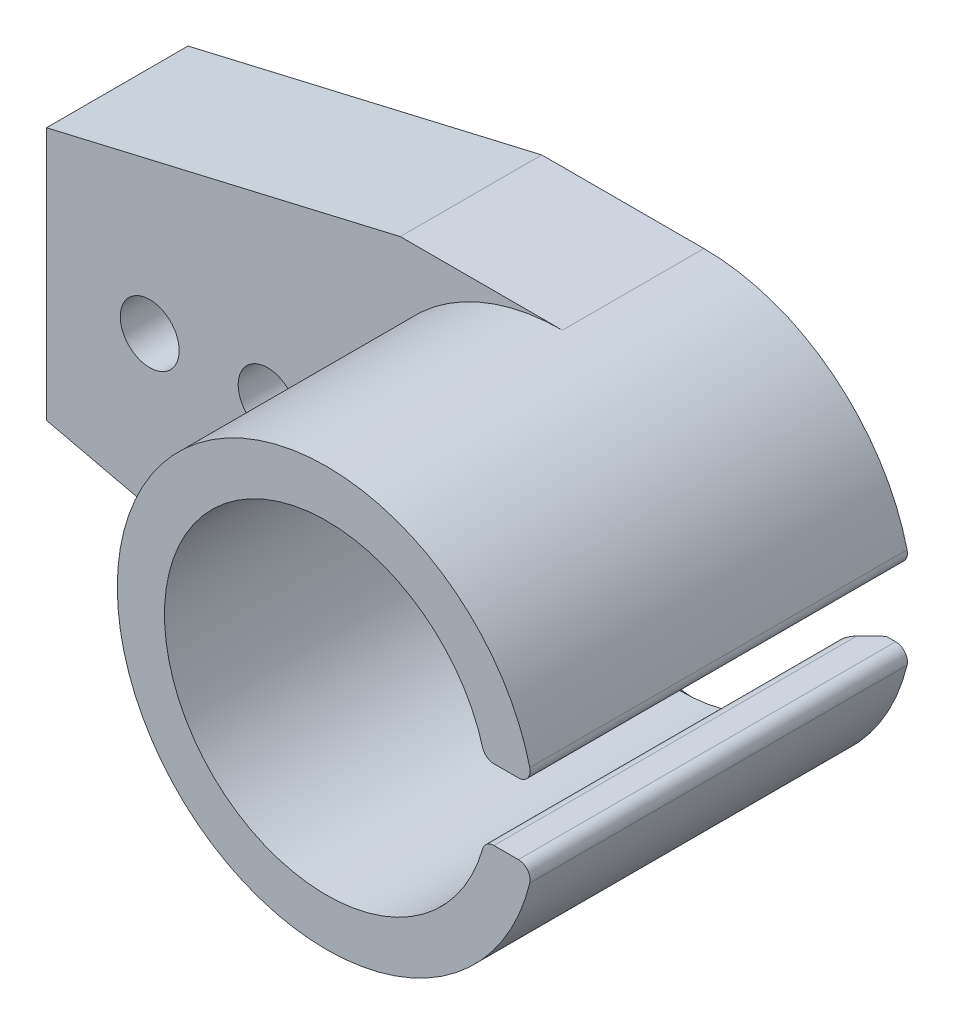
from build123d import *
from build123d.topology import SkipClean

# Parameters (mm, degrees)
ESQUISSE1_R             = 2.5
BOSS_EXTRU_1_DEPTH      = 32
CHANFREIN1_SIZE         = 2
CONG_2_R                = 1
ENL_V_MAT_EXTRU_1_DEPTH = 2
ENL_V_START             = -20
ENL_V_MAT_EXTRU_2_DEPTH = 20
ENL_V_MAT_EXTRU_3_DEPTH = 52.274993944


with BuildPart() as part:
    # Esquisse1 → Boss.-Extru.1 (new body)
    with BuildSketch(Plane.XY):
        with BuildLine():
            Line((13.4187369, 3), (17.494642037, 3))
            ThreePointArc((17.494642037, 3), (11.441426921, 13.570418195), (0, 17.75))
            Line((0, 17.75), (-43.75, 17.75))
            Line((-43.75, 17.75), (-43.75, -17.75))
            Line((-43.75, -17.75), (0, -17.75))
            ThreePointArc((0, -17.75), (11.441426921, -13.570418195), (17.494642037, -3))
            Line((17.494642037, -3), (13.4187369, -3))
            ThreePointArc((13.4187369, -3), (-13.75, 0), (13.4187369, 3))
        make_face()
        with Locations((-35, 0)):
            Circle(ESQUISSE1_R, mode=Mode.SUBTRACT)
        with Locations((-25, 0)):
            Circle(ESQUISSE1_R, mode=Mode.SUBTRACT)
    extrude(amount=BOSS_EXTRU_1_DEPTH)

    # Chanfrein1
    chanfrein1_edges = [part.edges().sort_by_distance(p)[0] for p in [
        (-13.75, 0, 0),
    ]]
    chamfer(chanfrein1_edges, length=CHANFREIN1_SIZE)

    # Congé2
    cong_2_edges = [part.edges().sort_by_distance(p)[0] for p in [
        (17.494642037, -3, 16),
        (17.494642037, 3, 16),
        (13.4187369, -3, 17),
        (13.4187369, 3, 17),
    ]]
    fillet(cong_2_edges, radius=CONG_2_R)

    # Esquisse2 → Enlèv. mat.-Extru.1 (cut)
    with BuildSketch(Plane(origin=(0, 0, 0), x_dir=(-1, 0, 0), z_dir=(0, 0, -1))):
        with BuildLine():
            Line((43.75, 10.1), (25, 10.1))
            ThreePointArc((25, 10.1), (14.9, 0), (25, -10.1))
            Line((25, -10.1), (43.75, -10.1))
            Line((43.75, -10.1), (43.75, 10.1))
        make_face()
    extrude(amount=-ENL_V_MAT_EXTRU_1_DEPTH, mode=Mode.SUBTRACT)

    # Esquisse3 → Enlèv. mat.-Extru.2 (cut)
    with SkipClean():  # the faces are left unmerged after this step: merging them gives an invalid solid
        with BuildSketch(Plane.XY.offset(32).offset(ENL_V_START)):
            with BuildLine():
                Line((0, 17.75), (-43.75, 17.75))
                Line((-43.75, 17.75), (-43.75, -17.75))
                Line((-43.75, -17.75), (0, -17.75))
                ThreePointArc((0, -17.75), (-17.75, 0), (0, 17.75))
            make_face()
        extrude(amount=ENL_V_MAT_EXTRU_2_DEPTH, mode=Mode.SUBTRACT)

    # Esquisse5 → Enlèv. mat.-Extru.3 (cut, through all)
    with SkipClean():  # the faces are left unmerged after this step: merging them gives an invalid solid
        with BuildSketch(Plane.XY.offset(12)):
            Polygon((-13.75, 17.75), (-43.75, 10.75), (-43.75, 17.75), align=None)
            Polygon((-43.75, -17.75), (-13.75, -17.75), (-43.75, -10.75), align=None)
        extrude(amount=-ENL_V_MAT_EXTRU_3_DEPTH, mode=Mode.SUBTRACT)


solid = part.part
